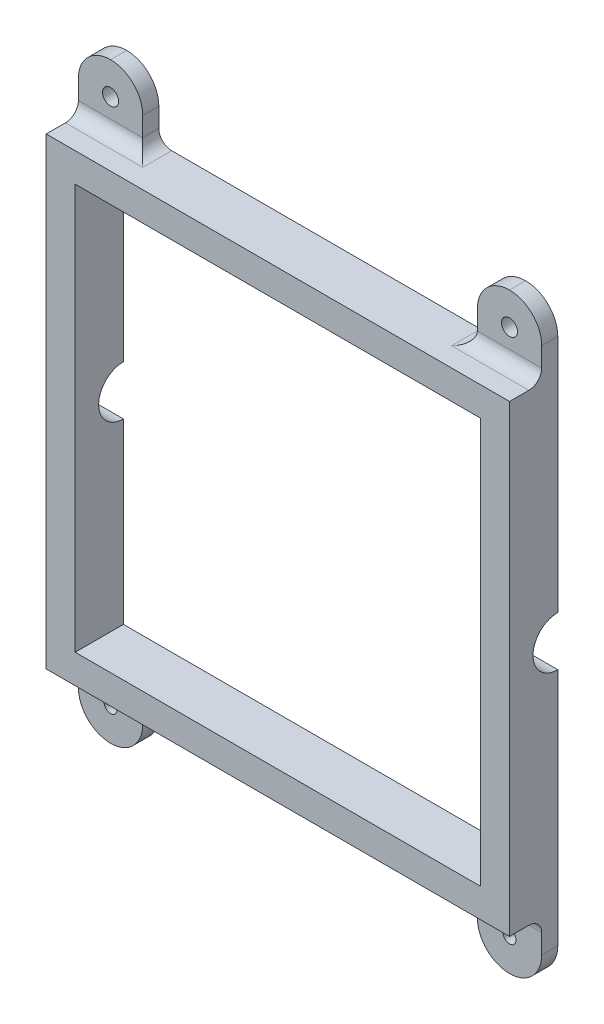
from build123d import *

# Parameters (mm, degrees)
SKETCH1_W            = 91.44
SKETCH1_H            = 91.44
BOSS_EXTRUDE1_DEPTH  = 9.525
SKETCH2_W            = 80.01
SKETCH2_H            = 80.01
CUT_EXTRUDE1_DEPTH   = 9.525
SKETCH3_R            = 4.8895
CUT_EXTRUDE2_DEPTH   = 103.675788894
SKETCH4_W            = 12.7
SKETCH4_H            = 12.7
BOSS_EXTRUDE2_DEPTH  = 3.175
SKETCH5_R            = 1.5875
CUT_EXTRUDE3_DEPTH   = 75.454934692
FILLET1_R            = 6.35
FILLET2_R            = 2.54
FILLET1_OF_MIRROR1_R = 6.35
FILLET2_OF_MIRROR1_R = 2.54
SKETCH6_W            = 12.7
SKETCH6_H            = 12.7
SKETCH6_R            = 1.27
BOSS_EXTRUDE3_DEPTH  = 3.175
FILLET3_R            = 2.54
FILLET4_R            = 6.35
FILLET3_OF_MIRROR7_R = 2.54
FILLET4_OF_MIRROR7_R = 6.35


with BuildPart() as part:
    # Sketch1 → Boss-Extrude1 (new body)
    with BuildSketch(Plane.XY):
        Rectangle(SKETCH1_W, SKETCH1_H)
    extrude(amount=BOSS_EXTRUDE1_DEPTH)

    # Sketch2 → Cut-Extrude1 (cut)
    with BuildSketch(Plane.XY.offset(9.525)):
        Rectangle(SKETCH2_W, SKETCH2_H)
    extrude(amount=-CUT_EXTRUDE1_DEPTH, mode=Mode.SUBTRACT)

    # Sketch3 → Cut-Extrude2 (cut, through all)
    with BuildSketch(Plane(origin=(45.72, 0, 0), x_dir=(0, 0, -1), z_dir=(1, 0, 0))):
        Circle(SKETCH3_R)
        with Locations((0, 57.404)):
            Circle(SKETCH3_R)
        with Locations((0, -57.404)):
            Circle(SKETCH3_R)
    extrude(amount=-CUT_EXTRUDE2_DEPTH, mode=Mode.SUBTRACT)

    # Sketch4 → Boss-Extrude2 (add)
    with BuildSketch(Plane(origin=(0, 0, 0), x_dir=(-1, 0, 0), z_dir=(0, 0, -1))):
        with Locations((-39.37, 52.07)):
            Rectangle(SKETCH4_W, SKETCH4_H)
    boss_extrude2 = extrude(amount=-BOSS_EXTRUDE2_DEPTH)

    # Sketch5 → Cut-Extrude3 (cut, through all)
    with BuildSketch(Plane.XY.offset(3.175)):
        with Locations((39.37, 52.07)):
            Circle(SKETCH5_R)
    cut_extrude3 = extrude(amount=-CUT_EXTRUDE3_DEPTH, mode=Mode.SUBTRACT)

    # Fillet1
    fillet1_edges = [part.edges().sort_by_distance(p)[0] for p in [
        (33.02, 58.42, 1.5875),
        (45.72, 58.42, 1.5875),
    ]]
    fillet(fillet1_edges, radius=FILLET1_R - 0.0001)  # a hair under: the kernel refuses the full size

    # Fillet2
    fillet2_edges = [part.edges().sort_by_distance(p)[0] for p in [
        (39.37, 45.72, 3.175),
        (33.02, 45.72, 1.5875),
    ]]
    fillet(fillet2_edges, radius=FILLET2_R)

    # Mirror1: Boss-Extrude2, Cut-Extrude3 across plane
    add(boss_extrude2.mirror(Plane(origin=(0, 0, 0), x_dir=(0, 0, 1), z_dir=(1, 0, 0))))
    add(cut_extrude3.mirror(Plane(origin=(0, 0, 0), x_dir=(0, 0, 1), z_dir=(1, 0, 0))), mode=Mode.SUBTRACT)

    # Fillet1 of Mirror1
    fillet1_of_mirror1_edges = [part.edges().sort_by_distance(p)[0] for p in [
        (-33.02, 58.42, 1.5875),
        (-45.72, 58.42, 1.5875),
    ]]
    fillet(fillet1_of_mirror1_edges, radius=FILLET1_OF_MIRROR1_R - 0.0001)  # a hair under: the kernel refuses the full size

    # Fillet2 of Mirror1
    fillet2_of_mirror1_edges = [part.edges().sort_by_distance(p)[0] for p in [
        (-39.37, 45.72, 3.175),
        (-33.02, 45.72, 1.5875),
    ]]
    fillet(fillet2_of_mirror1_edges, radius=FILLET2_OF_MIRROR1_R)

    # Sketch6 → Boss-Extrude3 (add)
    with BuildSketch(Plane(origin=(0, 0, 0), x_dir=(-1, 0, 0), z_dir=(0, 0, -1))):
        with Locations((-39.37, -52.07)):
            Rectangle(SKETCH6_W, SKETCH6_H)
        with Locations((-39.37, -52.07)):
            Circle(SKETCH6_R, mode=Mode.SUBTRACT)
    boss_extrude3 = extrude(amount=-BOSS_EXTRUDE3_DEPTH)

    # Fillet3
    fillet3_edges = [part.edges().sort_by_distance(p)[0] for p in [
        (39.37, -45.72, 3.175),
        (33.02, -45.72, 1.5875),
    ]]
    fillet(fillet3_edges, radius=FILLET3_R)

    # Fillet4
    fillet4_edges = [part.edges().sort_by_distance(p)[0] for p in [
        (45.72, -58.42, 1.5875),
        (33.02, -58.42, 1.5875),
    ]]
    fillet(fillet4_edges, radius=FILLET4_R - 0.0001)  # a hair under: the kernel refuses the full size

    # Mirror7: Boss-Extrude3 across plane
    add(boss_extrude3.mirror(Plane(origin=(0, 0, 0), x_dir=(0, 0, 1), z_dir=(1, 0, 0))))

    # Fillet3 of Mirror7
    fillet3_of_mirror7_edges = [part.edges().sort_by_distance(p)[0] for p in [
        (-39.37, -45.72, 3.175),
        (-33.02, -45.72, 1.5875),
    ]]
    fillet(fillet3_of_mirror7_edges, radius=FILLET3_OF_MIRROR7_R)

    # Fillet4 of Mirror7
    fillet4_of_mirror7_edges = [part.edges().sort_by_distance(p)[0] for p in [
        (-45.72, -58.42, 1.5875),
        (-33.02, -58.42, 1.5875),
    ]]
    fillet(fillet4_of_mirror7_edges, radius=FILLET4_OF_MIRROR7_R - 0.0001)  # a hair under: the kernel refuses the full size


solid = part.part
